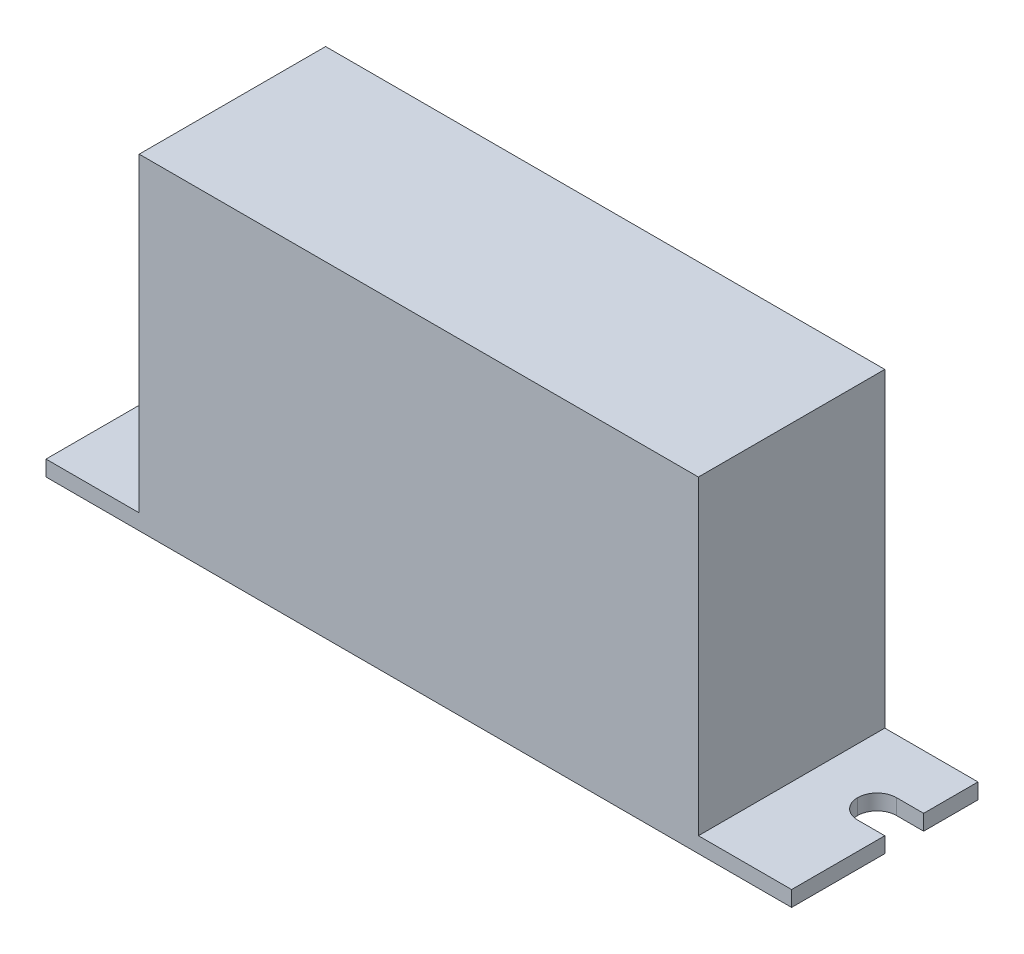
from build123d import *

# Parameters (mm, degrees)
BODY_DEPTH               = 24
SKETCH2_W                = 6
SKETCH2_H                = 5
FIXATION_CUTOUT_DEPTH    = 107.733312513
FIXATION_CUTOUT_ROUNDS_R = 2.5


with BuildPart() as part:
    # Sketch1 → body (new body)
    with BuildSketch(Plane.XY):
        Polygon((0, 0), (96, 0), (96, 2), (84, 2), (84, 42), (12, 42), (12, 2), (0, 2), align=None)
    extrude(amount=BODY_DEPTH)

    # Sketch2 → fixation_cutout (cut, through all)
    with BuildSketch(Plane(origin=(0, 2, 0), x_dir=(1, 0, 0), z_dir=(0, 1, 0))):
        with Locations((3, -9.5)):
            Rectangle(SKETCH2_W, SKETCH2_H)
        with Locations((93, -9.5)):
            Rectangle(SKETCH2_W, SKETCH2_H)
    extrude(amount=-FIXATION_CUTOUT_DEPTH, mode=Mode.SUBTRACT)

    # fixation_cutout_rounds
    fixation_cutout_rounds_edges = [part.edges().sort_by_distance(p)[0] for p in [
        (90, 1, 12),
        (90, 1, 7),
        (6, 1, 12),
        (6, 1, 7),
    ]]
    fillet(fixation_cutout_rounds_edges, radius=FIXATION_CUTOUT_ROUNDS_R - 0.0001)  # a hair under: the kernel refuses the full size


solid = part.part
